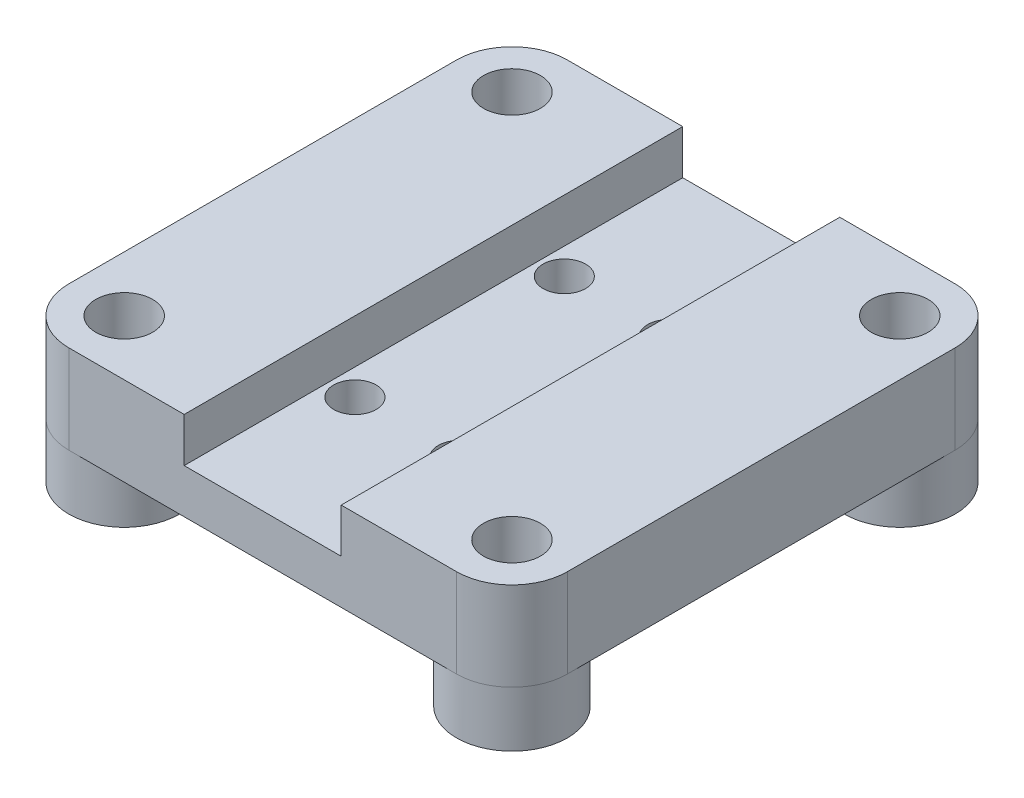
from build123d import *

# Parameters (mm, degrees)
BOSS_EXTRUDE1_DEPTH   = 14.2875
F_4_CLEARANCE_HOLE1_D = 3.2639
BOSS_EXTRUDE2_START   = 3.175
SKETCH6_R             = 3.175
SKETCH6_R_2           = 1.63195
BOSS_EXTRUDE2_DEPTH   = 3.175
FILLET1_R             = 3.175
F_2_CLEARANCE_HOLE2_D = 2.4384


with BuildPart() as part:
    # Sketch2 → Boss-Extrude1 (new, symmetric)
    with BuildSketch(Plane.XY):
        Polygon((-14.2875, 0), (-14.2875, 5.08), (-4.5, 5.08), (-4.5, 2.54), (4.5, 2.54), (4.5, 5.08), (14.2875, 5.08), (14.2875, 0), align=None)
    extrude(amount=BOSS_EXTRUDE1_DEPTH, both=True)

    # #4 Clearance Hole1 (through all)
    with Locations(Plane(origin=(0, 5.08, 0), x_dir=(1, 0, 0), z_dir=(0, 1, 0))):
        with Locations((-11.1125, 11.1125), (11.1125, -11.1125), (11.1125, 11.1125), (-11.1125, -11.1125)):
            Hole(F_4_CLEARANCE_HOLE1_D / 2)

    # Sketch6 → Boss-Extrude2 (add)
    # profile 1 of 4: a face of its own
    with BuildSketch(Plane.XZ.offset(BOSS_EXTRUDE2_START)):
        with Locations(Location((-11.1125, 11.1125, 0), (0, 0, 180))):
            Circle(SKETCH6_R)
        with Locations(Location((-11.1125, 11.1125, 0), (0, 0, 90))):
            Circle(SKETCH6_R_2, mode=Mode.SUBTRACT)
    # profile 2 of 4: a face of its own
    with BuildSketch(Plane.XZ.offset(BOSS_EXTRUDE2_START)):
        with Locations((11.1125, 11.1125)):
            Circle(SKETCH6_R)
        with Locations(Location((11.1125, 11.1125, 0), (0, 0, 90))):
            Circle(SKETCH6_R_2, mode=Mode.SUBTRACT)
    # profile 3 of 4: a face of its own
    with BuildSketch(Plane.XZ.offset(BOSS_EXTRUDE2_START)):
        with Locations((11.1125, -11.1125)):
            Circle(SKETCH6_R)
        with Locations(Location((11.1125, -11.1125, 0), (0, 0, 90))):
            Circle(SKETCH6_R_2, mode=Mode.SUBTRACT)
    # profile 4 of 4: a face of its own
    with BuildSketch(Plane.XZ.offset(BOSS_EXTRUDE2_START)):
        with Locations(Location((-11.1125, -11.1125, 0), (0, 0, 180))):
            Circle(SKETCH6_R)
        with Locations(Location((-11.1125, -11.1125, 0), (0, 0, 90))):
            Circle(SKETCH6_R_2, mode=Mode.SUBTRACT)
    extrude(amount=-BOSS_EXTRUDE2_DEPTH)

    # Fillet1
    fillet1_edges = [part.edges().sort_by_distance(p)[0] for p in [
        (-14.2875, 2.54, -14.2875),
        (-14.2875, 2.54, 14.2875),
        (14.2875, 2.54, -14.2875),
        (14.2875, 2.54, 14.2875),
    ]]
    fillet(fillet1_edges, radius=FILLET1_R - 0.0001)  # a hair under: the kernel refuses the full size

    # #2 Clearance Hole2 (through all)
    with Locations(Plane(origin=(0, 2.54, 0), x_dir=(1, 0, 0), z_dir=(0, 1, 0))):
        with Locations((-2.999999969, 5.999999938), (2.999999969, -5.999999938), (2.999999969, 5.999999938), (-2.999999969, -5.999999938)):
            Hole(F_2_CLEARANCE_HOLE2_D / 2)


solid = part.part
